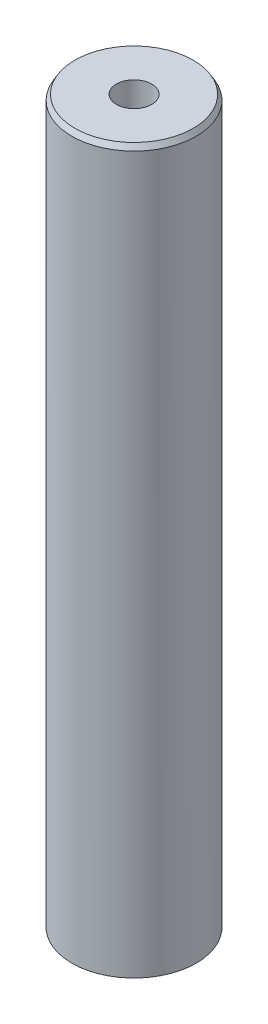
from build123d import *
from OCP.BRepFilletAPI import BRepFilletAPI_MakeChamfer

# Parameters (mm, degrees)
SKETCH1_R           = 22.5
BOSS_EXTRUDE1_DEPTH = 262.07603574
SKETCH2_R           = 6.395114276
CUT_EXTRUDE1_DEPTH  = 265.000660054
CHAMFER1_SIZE       = 1.925016767
CHAMFER1_SIZE2      = 1.111408948


with BuildPart() as part:
    # Sketch1 → Boss-Extrude1 (new body)
    with BuildSketch(Plane(origin=(0, 0, 0), x_dir=(1, 0, 0), z_dir=(0, 1, 0))):
        Circle(SKETCH1_R)
    extrude(amount=BOSS_EXTRUDE1_DEPTH)

    # Sketch2 → Cut-Extrude1 (cut, through all)
    with BuildSketch(Plane(origin=(0, 0, 0), x_dir=(1, 0, 0), z_dir=(0, 1, 0))):
        Circle(SKETCH2_R)
    extrude(amount=CUT_EXTRUDE1_DEPTH, mode=Mode.SUBTRACT)

    # Chamfer1: one chamfer whose edges measure the first distance from different faces: ONE call of the kernel's chamfer builder (chamfer() names one face for all edges)
    chamfer1_edges_1 = [part.edges().sort_by_distance(p)[0] for p in [
        (-22.5, 262.07603574, 0),
    ]]
    chamfer1_side_1 = [part.faces().sort_by_distance(p)[0] for p in [
        (-22.5, 131.03801787, 0),
    ]]
    chamfer1_edges_2 = [part.edges().sort_by_distance(p)[0] for p in [
        (-22.5, 0, 0),
    ]]
    chamfer1_side_2 = [part.faces().sort_by_distance(p)[0] for p in [
        (-21.863603897, 0, 0),
    ]]
    chamfer1 = BRepFilletAPI_MakeChamfer(part.part.solid().wrapped)
    for e in chamfer1_edges_1:
        chamfer1.Add(CHAMFER1_SIZE, CHAMFER1_SIZE2, e.wrapped, chamfer1_side_1[0].wrapped)  # the first distance lies on this face
    for e in chamfer1_edges_2:
        chamfer1.Add(CHAMFER1_SIZE, CHAMFER1_SIZE2, e.wrapped, chamfer1_side_2[0].wrapped)  # the first distance lies on this face
    add(Compound.cast(chamfer1.Shape()), mode=Mode.REPLACE)


solid = part.part
